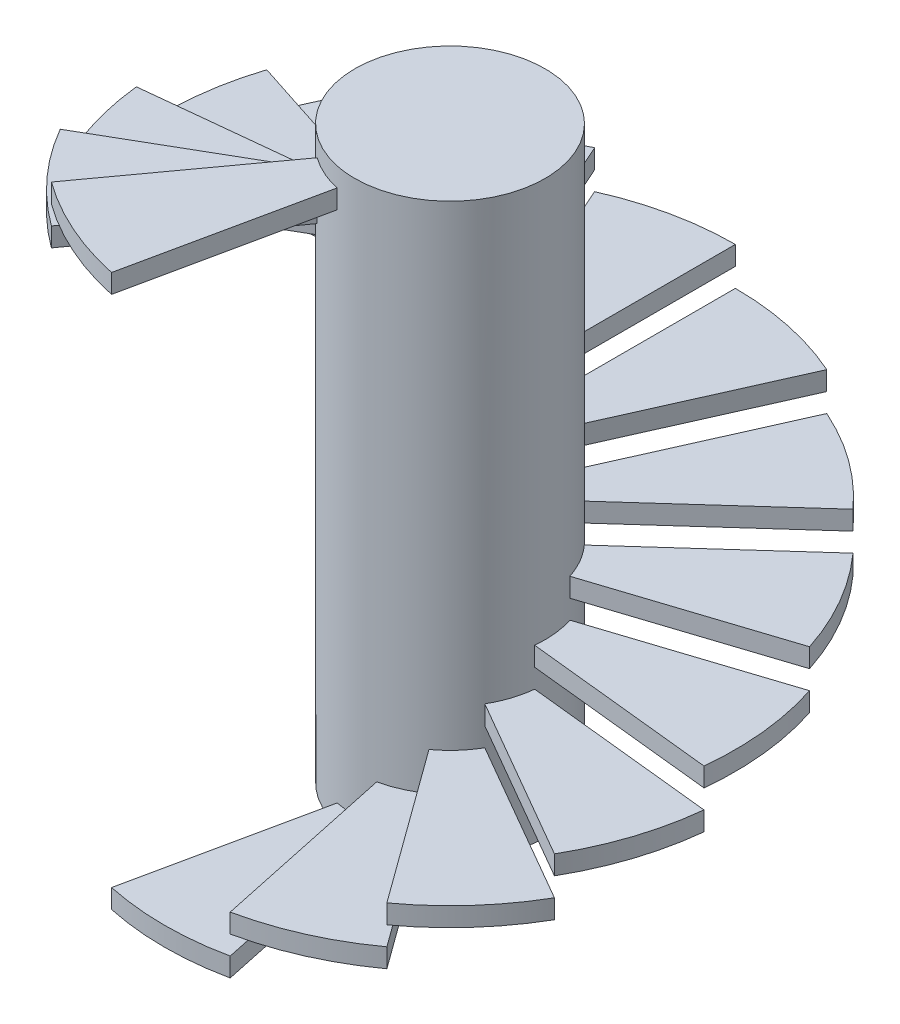
from build123d import *

# Parameters (mm, degrees)
SKETCH_1_R      = 50
EXTRUDE_1_DEPTH = 300
EXTRUDE_2_DEPTH = 10


with BuildPart() as part:
    # 草圖1 → 填料-伸長1 (new body)
    with BuildSketch(Plane(origin=(0, 0, 0), x_dir=(1, 0, 0), z_dir=(0, 1, 0))):
        with Locations(Location((0, 0, 0), (0, 0, 270))):
            Circle(SKETCH_1_R)
    extrude(amount=EXTRUDE_1_DEPTH)

    # 草圖7 → 填料-伸長2 (add)
    with BuildSketch(Plane(origin=(0, 0, 0), x_dir=(1, 0, 0), z_dir=(0, 1, 0))):
        with BuildLine():
            Line((-10.395584541, -48.907380037), (-31.186753623, -146.72214011))
            ThreePointArc((-31.186753623, -146.72214011), (0, -150), (31.186753623, -146.72214011))
            Line((31.186753623, -146.72214011), (10.395584541, -48.907380037))
            ThreePointArc((10.395584541, -48.907380037), (0, -50), (-10.395584541, -48.907380037))
        make_face()
    extrude(amount=EXTRUDE_2_DEPTH)

    # 曲線導出複製排列1: read off the stored shape, not the designer's step
    # 曲線導出複製排列1: loft between two sections, ruled curve by curve
    pattern_curve_1_from = [
        Edge.make_three_point_arc((88.166854209, 29.999606099, 121.353229236), (61.00944139, 29.999627457, 137.03228839), (31.185623499, 29.999648814, 146.722378865)),
        Edge.make_line((31.185623499, 29.999648814, 146.722378865), (10.3952123, 29.999634576, 48.907459157)),
        Edge.make_line((29.388954737, 29.999620338, 40.451073403), (88.166854209, 29.999606099, 121.353229236)),
        Edge.make_line((29.388954737, 29.999620338, 40.451073403), (10.3952123, 29.999634576, 48.907459157)),
    ]
    pattern_curve_1_to = [
        Edge.make_three_point_arc((88.166847953, 19.999606099, 121.353232022), (61.009435133, 19.999627457, 137.032291175), (31.185617243, 19.999648814, 146.72238165)),
        Edge.make_line((31.185617243, 19.999648814, 146.72238165), (10.395205748, 19.999634576, 48.90746055)),
        Edge.make_line((29.388949318, 19.999620338, 40.451077341), (88.166847953, 19.999606099, 121.353232022)),
        Edge.make_line((29.388949318, 19.999620338, 40.451077341), (10.395205748, 19.999634576, 48.90746055)),
    ]
    pattern_curve_1 = Solid(Shell([*[Face.make_surface_from_curves(pattern_curve_1_from[k], pattern_curve_1_to[k]) for k in range(4)], Face(Wire(pattern_curve_1_from)), Face(Wire(pattern_curve_1_to))]))
    add(pattern_curve_1)

    # Pattern Curve 1 2: loft between two sections, ruled curve by curve
    pattern_curve_1_2_from = [
        Edge.make_three_point_arc((129.902850728, 49.999428516, 75.001657031), (111.470442269, 49.999387758, 100.371014244), (88.166240206, 49.999347, 121.353676925)),
        Edge.make_line((88.166240206, 49.999347, 121.353676925), (29.388739308, 49.999374172, 40.451229918)),
        Edge.make_line((43.300946766, 49.999401344, 25.000560177), (129.902850728, 49.999428516, 75.001657031)),
        Edge.make_line((43.300946766, 49.999401344, 25.000560177), (29.388739308, 49.999374172, 40.451229918)),
    ]
    pattern_curve_1_2_to = [
        Edge.make_three_point_arc((129.902859473, 39.999428516, 75.001647319), (111.470451014, 39.999387758, 100.371004532), (88.166248951, 39.999347, 121.353667213)),
        Edge.make_line((88.166248951, 39.999347, 121.353667213), (29.38874965, 39.999374172, 40.451222404)),
        Edge.make_line((43.300953158, 39.999401344, 25.000549106), (129.902859473, 39.999428516, 75.001647319)),
        Edge.make_line((43.300953158, 39.999401344, 25.000549106), (29.38874965, 39.999374172, 40.451222404)),
    ]
    pattern_curve_1_2 = Solid(Shell([*[Face.make_surface_from_curves(pattern_curve_1_2_from[k], pattern_curve_1_2_to[k]) for k in range(4)], Face(Wire(pattern_curve_1_2_from)), Face(Wire(pattern_curve_1_2_to))]))
    add(pattern_curve_1_2)

    # Pattern Curve 1 3: loft between two sections, ruled curve by curve
    pattern_curve_1_3_from = [
        Edge.make_three_point_arc((149.178354042, 70.000263463, 15.678583971), (142.658690297, 70.000228957, 46.351894057), (129.904157085, 70.00019445, 74.999404412)),
        Edge.make_line((129.904157085, 70.00019445, 74.999404412), (43.301381423, 70.000217454, 24.999807336)),
        Edge.make_line((49.726118022, 70.000240459, 5.226201913), (149.178354042, 70.000263463, 15.678583971)),
        Edge.make_line((49.726118022, 70.000240459, 5.226201913), (43.301381423, 70.000217454, 24.999807336)),
    ]
    pattern_curve_1_3_to = [
        Edge.make_three_point_arc((149.178357461, 60.000263463, 15.678573448), (142.658693716, 60.000228957, 46.351883534), (129.904160504, 60.00019445, 74.999393888)),
        Edge.make_line((129.904160504, 60.00019445, 74.999393888), (43.301386835, 60.000217454, 24.999797963)),
        Edge.make_line((49.726119154, 60.000240459, 5.226191149), (149.178357461, 60.000263463, 15.678573448)),
        Edge.make_line((49.726119154, 60.000240459, 5.226191149), (43.301386835, 60.000217454, 24.999797963)),
    ]
    pattern_curve_1_3 = Solid(Shell([*[Face.make_surface_from_curves(pattern_curve_1_3_from[k], pattern_curve_1_3_to[k]) for k in range(4)], Face(Wire(pattern_curve_1_3_from)), Face(Wire(pattern_curve_1_3_to))]))
    add(pattern_curve_1_3)

    # Pattern Curve 1 4: loft between two sections, ruled curve by curve
    pattern_curve_1_4_from = [
        Edge.make_three_point_arc((142.658547258, 89.999899948, -46.352339417), (149.178307393, 89.999923711, -15.679049819), (149.178259624, 89.999947474, 15.679489161)),
        Edge.make_line((149.178259624, 89.999947474, 15.679489161), (49.726087586, 89.999931632, 5.226491501)),
        Edge.make_line((47.552847048, 89.99991579, -15.450784368), (142.658547258, 89.999899948, -46.352339417)),
        Edge.make_line((47.552847048, 89.99991579, -15.450784368), (49.726087586, 89.999931632, 5.226491501)),
    ]
    pattern_curve_1_4_to = [
        Edge.make_three_point_arc((142.658548055, 79.999899948, -46.35233184), (149.17830819, 79.999923711, -15.679042242), (149.17826042, 79.999947474, 15.679496739)),
        Edge.make_line((149.17826042, 79.999947474, 15.679496739), (49.726086807, 79.999931632, 5.226498913)),
        Edge.make_line((47.552849352, 79.99991579, -15.45077728), (142.658548055, 79.999899948, -46.35233184)),
        Edge.make_line((47.552849352, 79.99991579, -15.45077728), (49.726086807, 79.999931632, 5.226498913)),
    ]
    pattern_curve_1_4 = Solid(Shell([*[Face.make_surface_from_curves(pattern_curve_1_4_from[k], pattern_curve_1_4_to[k]) for k in range(4)], Face(Wire(pattern_curve_1_4_from)), Face(Wire(pattern_curve_1_4_to))]))
    add(pattern_curve_1_4)

    # Pattern Curve 1 5: loft between two sections, ruled curve by curve
    pattern_curve_1_5_from = [
        Edge.make_three_point_arc((111.472538635, 109.99969912, -100.368677975), (129.904422692, 109.99961853, -74.99893976), (142.658860691, 109.99953794, -46.351387014)),
        Edge.make_line((142.658860691, 109.99953794, -46.351387014), (47.552957068, 109.999591667, -15.450445758)),
        Edge.make_line((37.157525485, 109.999645394, -33.456214667), (111.472538635, 109.99969912, -100.368677975)),
        Edge.make_line((37.157525485, 109.999645394, -33.456214667), (47.552957068, 109.999591667, -15.450445758)),
    ]
    pattern_curve_1_5_to = [
        Edge.make_three_point_arc((111.472525715, 99.99969912, -100.368700354), (129.904409772, 99.99961853, -74.998962139), (142.658847771, 99.99953794, -46.351409393)),
        Edge.make_line((142.658847771, 99.99953794, -46.351409393), (47.552949257, 99.999591667, -15.450469798)),
        Edge.make_line((37.157508572, 99.999645394, -33.456233451), (111.472525715, 99.99969912, -100.368700354)),
        Edge.make_line((37.157508572, 99.999645394, -33.456233451), (47.552949257, 99.999591667, -15.450469798)),
    ]
    pattern_curve_1_5 = Solid(Shell([*[Face.make_surface_from_curves(pattern_curve_1_5_from[k], pattern_curve_1_5_to[k]) for k in range(4)], Face(Wire(pattern_curve_1_5_from)), Face(Wire(pattern_curve_1_5_to))]))
    add(pattern_curve_1_5)

    # Pattern Curve 1 6: loft between two sections, ruled curve by curve
    pattern_curve_1_6_from = [
        Edge.make_three_point_arc((61.009186737, 130.000434016, -137.032403499), (88.166627272, 130.000457764, -121.353392352), (111.470762857, 130.000481511, -100.370655837)),
        Edge.make_line((111.470762857, 130.000481511, -100.370655837), (37.156918022, 130.000465679, -33.456889322)),
        Edge.make_line((20.336390828, 130.000449848, -45.67746937), (61.009186737, 130.000434016, -137.032403499)),
        Edge.make_line((20.336390828, 130.000449848, -45.67746937), (37.156918022, 130.000465679, -33.456889322)),
    ]
    pattern_curve_1_6_to = [
        Edge.make_three_point_arc((61.009192897, 120.000434016, -137.032399023), (88.166633433, 120.000457764, -121.353387877), (111.470769017, 120.000481511, -100.370651362)),
        Edge.make_line((111.470769017, 120.000481511, -100.370651362), (37.156923006, 120.00046568, -33.456883787)),
        Edge.make_line((20.336397632, 120.000449848, -45.677466341), (61.009192897, 120.000434016, -137.032399023)),
        Edge.make_line((20.336397632, 120.000449848, -45.677466341), (37.156923006, 120.00046568, -33.456883787)),
    ]
    pattern_curve_1_6 = Solid(Shell([*[Face.make_surface_from_curves(pattern_curve_1_6_from[k], pattern_curve_1_6_to[k]) for k in range(4)], Face(Wire(pattern_curve_1_6_from)), Face(Wire(pattern_curve_1_6_to))]))
    add(pattern_curve_1_6)

    # Pattern Curve 1 7: loft between two sections, ruled curve by curve
    pattern_curve_1_7_from = [
        Edge.make_three_point_arc((-0.000487877, 150.00018683, -149.999997716), (31.186276641, 150.000152588, -146.722241495), (61.010051692, 150.000118346, -137.032019169)),
        Edge.make_line((61.010051692, 150.000118346, -137.032019169), (20.336690129, 150.000141174, -45.677336116)),
        Edge.make_line((-0.000155466, 150.000164002, -50), (-0.000487877, 150.00018683, -149.999997716)),
        Edge.make_line((-0.000155466, 150.000164002, -50), (20.336690129, 150.000141174, -45.677336116)),
    ]
    pattern_curve_1_7_to = [
        Edge.make_three_point_arc((-0.000498617, 140.00018683, -149.999999999), (31.186265902, 140.000152588, -146.722243778), (61.010040952, 140.000118346, -137.032021451)),
        Edge.make_line((61.010040952, 140.000118346, -137.032021451), (20.336680317, 140.000141174, -45.677340484)),
        Edge.make_line((-0.000166206, 140.000164002, -50), (-0.000498617, 140.00018683, -149.999999999)),
        Edge.make_line((-0.000166206, 140.000164002, -50), (20.336680317, 140.000141174, -45.677340484)),
    ]
    pattern_curve_1_7 = Solid(Shell([*[Face.make_surface_from_curves(pattern_curve_1_7_from[k], pattern_curve_1_7_to[k]) for k in range(4)], Face(Wire(pattern_curve_1_7_from)), Face(Wire(pattern_curve_1_7_to))]))
    add(pattern_curve_1_7)

    # Pattern Curve 1 8: loft between two sections, ruled curve by curve
    pattern_curve_1_8_from = [
        Edge.make_three_point_arc((-61.010030212, 169.999881654, -137.032023734), (-31.186255162, 169.999847412, -146.72224606), (0.000509357, 169.99981317, -150.000002282)),
        Edge.make_line((0.000509357, 169.99981317, -150.000002282), (0.000176945, 169.999835998, -50)),
        Edge.make_line((-20.336670506, 169.999858826, -45.677344852), (-61.010030212, 169.999881654, -137.032023734)),
        Edge.make_line((-20.336670506, 169.999858826, -45.677344852), (0.000176945, 169.999835998, -50)),
    ]
    pattern_curve_1_8_to = [
        Edge.make_three_point_arc((-61.010040952, 159.999881654, -137.032021451), (-31.186265902, 159.999847412, -146.722243778), (0.000498617, 159.99981317, -149.999999999)),
        Edge.make_line((0.000498617, 159.99981317, -149.999999999), (0.000166206, 159.999835998, -50)),
        Edge.make_line((-20.336680317, 159.999858826, -45.677340484), (-61.010040952, 159.999881654, -137.032021451)),
        Edge.make_line((-20.336680317, 159.999858826, -45.677340484), (0.000166206, 159.999835998, -50)),
    ]
    pattern_curve_1_8 = Solid(Shell([*[Face.make_surface_from_curves(pattern_curve_1_8_from[k], pattern_curve_1_8_to[k]) for k in range(4)], Face(Wire(pattern_curve_1_8_from)), Face(Wire(pattern_curve_1_8_to))]))
    add(pattern_curve_1_8)

    # Pattern Curve 1 9: loft between two sections, ruled curve by curve
    pattern_curve_1_9_from = [
        Edge.make_three_point_arc((-111.470775177, 189.999518489, -100.370646886), (-88.166639593, 189.999542236, -121.353383401), (-61.009199058, 189.999565984, -137.032394547)),
        Edge.make_line((-61.009199058, 189.999565984, -137.032394547), (-20.336404437, 189.999550152, -45.677463312)),
        Edge.make_line((-37.15692799, 189.99953432, -33.456878252), (-111.470775177, 189.999518489, -100.370646886)),
        Edge.make_line((-37.15692799, 189.99953432, -33.456878252), (-20.336404437, 189.999550152, -45.677463312)),
    ]
    pattern_curve_1_9_to = [
        Edge.make_three_point_arc((-111.470769017, 179.999518489, -100.370651362), (-88.166633433, 179.999542236, -121.353387877), (-61.009192897, 179.999565984, -137.032399023)),
        Edge.make_line((-61.009192897, 179.999565984, -137.032399023), (-20.336397632, 179.999550152, -45.677466341)),
        Edge.make_line((-37.156923006, 179.99953432, -33.456883787), (-111.470769017, 179.999518489, -100.370651362)),
        Edge.make_line((-37.156923006, 179.99953432, -33.456883787), (-20.336397632, 179.999550152, -45.677466341)),
    ]
    pattern_curve_1_9 = Solid(Shell([*[Face.make_surface_from_curves(pattern_curve_1_9_from[k], pattern_curve_1_9_to[k]) for k in range(4)], Face(Wire(pattern_curve_1_9_from)), Face(Wire(pattern_curve_1_9_to))]))
    add(pattern_curve_1_9)

    # Pattern Curve 1 10: loft between two sections, ruled curve by curve
    pattern_curve_1_10_from = [
        Edge.make_three_point_arc((-142.65883485, 210.000462059, -46.351431772), (-129.904396851, 210.00038147, -74.998984518), (-111.472512795, 210.00030088, -100.368722733)),
        Edge.make_line((-111.472512795, 210.00030088, -100.368722733), (-37.157491659, 210.000354606, -33.456252235)),
        Edge.make_line((-47.552941446, 210.000408333, -15.450493837), (-142.65883485, 210.000462059, -46.351431772)),
        Edge.make_line((-47.552941446, 210.000408333, -15.450493837), (-37.157491659, 210.000354606, -33.456252235)),
    ]
    pattern_curve_1_10_to = [
        Edge.make_three_point_arc((-142.658847771, 200.00046206, -46.351409393), (-129.904409772, 200.00038147, -74.998962139), (-111.472525715, 200.00030088, -100.368700354)),
        Edge.make_line((-111.472525715, 200.00030088, -100.368700354), (-37.157508572, 200.000354606, -33.456233451)),
        Edge.make_line((-47.552949257, 200.000408333, -15.450469798), (-142.658847771, 200.00046206, -46.351409393)),
        Edge.make_line((-47.552949257, 200.000408333, -15.450469798), (-37.157508572, 200.000354606, -33.456233451)),
    ]
    pattern_curve_1_10 = Solid(Shell([*[Face.make_surface_from_curves(pattern_curve_1_10_from[k], pattern_curve_1_10_to[k]) for k in range(4)], Face(Wire(pattern_curve_1_10_from)), Face(Wire(pattern_curve_1_10_to))]))
    add(pattern_curve_1_10)

    # Pattern Curve 1 11: loft between two sections, ruled curve by curve
    pattern_curve_1_11_from = [
        Edge.make_three_point_arc((-149.178261217, 230.000052526, 15.679504316), (-149.178308986, 230.000076289, -15.679034664), (-142.658548851, 230.000100052, -46.352324262)),
        Edge.make_line((-142.658548851, 230.000100052, -46.352324262), (-47.552851655, 230.00008421, -15.450770192)),
        Edge.make_line((-49.726086028, 230.000068368, 5.226506325), (-149.178261217, 230.000052526, 15.679504316)),
        Edge.make_line((-49.726086028, 230.000068368, 5.226506325), (-47.552851655, 230.00008421, -15.450770192)),
    ]
    pattern_curve_1_11_to = [
        Edge.make_three_point_arc((-149.17826042, 220.000052526, 15.679496739), (-149.17830819, 220.000076289, -15.679042242), (-142.658548055, 220.000100052, -46.35233184)),
        Edge.make_line((-142.658548055, 220.000100052, -46.35233184), (-47.552849352, 220.00008421, -15.45077728)),
        Edge.make_line((-49.726086807, 220.000068368, 5.226498913), (-149.17826042, 220.000052526, 15.679496739)),
        Edge.make_line((-49.726086807, 220.000068368, 5.226498913), (-47.552849352, 220.00008421, -15.45077728)),
    ]
    pattern_curve_1_11 = Solid(Shell([*[Face.make_surface_from_curves(pattern_curve_1_11_from[k], pattern_curve_1_11_to[k]) for k in range(4)], Face(Wire(pattern_curve_1_11_from)), Face(Wire(pattern_curve_1_11_to))]))
    add(pattern_curve_1_11)

    # Pattern Curve 1 12: loft between two sections, ruled curve by curve
    pattern_curve_1_12_from = [
        Edge.make_three_point_arc((-129.904163923, 249.99980555, 74.999383365), (-142.658697135, 249.999771043, 46.351873011), (-149.17836088, 249.999736537, 15.678562925)),
        Edge.make_line((-149.17836088, 249.999736537, 15.678562925), (-49.726120285, 249.999759541, 5.226180386)),
        Edge.make_line((-43.301392246, 249.999782546, 24.99978859), (-129.904163923, 249.99980555, 74.999383365)),
        Edge.make_line((-43.301392246, 249.999782546, 24.99978859), (-49.726120285, 249.999759541, 5.226180386)),
    ]
    pattern_curve_1_12_to = [
        Edge.make_three_point_arc((-129.904160504, 239.99980555, 74.999393888), (-142.658693716, 239.999771043, 46.351883534), (-149.178357461, 239.999736537, 15.678573448)),
        Edge.make_line((-149.178357461, 239.999736537, 15.678573448), (-49.726119154, 239.999759541, 5.226191149)),
        Edge.make_line((-43.301386835, 239.999782546, 24.999797963), (-129.904160504, 239.99980555, 74.999393888)),
        Edge.make_line((-43.301386835, 239.999782546, 24.999797963), (-49.726119154, 239.999759541, 5.226191149)),
    ]
    pattern_curve_1_12 = Solid(Shell([*[Face.make_surface_from_curves(pattern_curve_1_12_from[k], pattern_curve_1_12_to[k]) for k in range(4)], Face(Wire(pattern_curve_1_12_from)), Face(Wire(pattern_curve_1_12_to))]))
    add(pattern_curve_1_12)

    # Pattern Curve 1 13: loft between two sections, ruled curve by curve
    pattern_curve_1_13_from = [
        Edge.make_three_point_arc((-88.166257696, 270.000653, 121.3536575), (-111.470459759, 270.000612242, 100.37099482), (-129.902868218, 270.000571484, 75.001637607)),
        Edge.make_line((-129.902868218, 270.000571484, 75.001637607), (-43.30095955, 270.000598656, 25.000538036)),
        Edge.make_line((-29.388759992, 270.000625828, 40.45121489), (-88.166257696, 270.000653, 121.3536575)),
        Edge.make_line((-29.388759992, 270.000625828, 40.45121489), (-43.30095955, 270.000598656, 25.000538036)),
    ]
    pattern_curve_1_13_to = [
        Edge.make_three_point_arc((-88.166248951, 260.000653, 121.353667213), (-111.470451014, 260.000612242, 100.371004532), (-129.902859473, 260.000571484, 75.001647319)),
        Edge.make_line((-129.902859473, 260.000571484, 75.001647319), (-43.300953158, 260.000598656, 25.000549106)),
        Edge.make_line((-29.38874965, 260.000625828, 40.451222404), (-88.166248951, 260.000653, 121.353667213)),
        Edge.make_line((-29.38874965, 260.000625828, 40.451222404), (-43.300953158, 260.000598656, 25.000549106)),
    ]
    pattern_curve_1_13 = Solid(Shell([*[Face.make_surface_from_curves(pattern_curve_1_13_from[k], pattern_curve_1_13_to[k]) for k in range(4)], Face(Wire(pattern_curve_1_13_from)), Face(Wire(pattern_curve_1_13_to))]))
    add(pattern_curve_1_13)

    # Pattern Curve 1 14: loft between two sections, ruled curve by curve
    pattern_curve_1_14_from = [
        Edge.make_three_point_arc((-31.185610987, 290.000351186, 146.722384436), (-61.009428877, 290.000372543, 137.03229396), (-88.166841697, 290.000393901, 121.353234807)),
        Edge.make_line((-88.166841697, 290.000393901, 121.353234807), (-29.388943898, 290.000379662, 40.451081278)),
        Edge.make_line((-10.395199196, 290.000365424, 48.907461943), (-31.185610987, 290.000351186, 146.722384436)),
        Edge.make_line((-10.395199196, 290.000365424, 48.907461943), (-29.388943898, 290.000379662, 40.451081278)),
    ]
    pattern_curve_1_14_to = [
        Edge.make_three_point_arc((-31.185617243, 280.000351186, 146.72238165), (-61.009435133, 280.000372543, 137.032291175), (-88.166847953, 280.000393901, 121.353232022)),
        Edge.make_line((-88.166847953, 280.000393901, 121.353232022), (-29.388949318, 280.000379662, 40.451077341)),
        Edge.make_line((-10.395205748, 280.000365424, 48.90746055), (-31.185617243, 280.000351186, 146.72238165)),
        Edge.make_line((-10.395205748, 280.000365424, 48.90746055), (-29.388949318, 280.000379662, 40.451077341)),
    ]
    pattern_curve_1_14 = Solid(Shell([*[Face.make_surface_from_curves(pattern_curve_1_14_from[k], pattern_curve_1_14_to[k]) for k in range(4)], Face(Wire(pattern_curve_1_14_from)), Face(Wire(pattern_curve_1_14_to))]))
    add(pattern_curve_1_14)


solid = part.part
